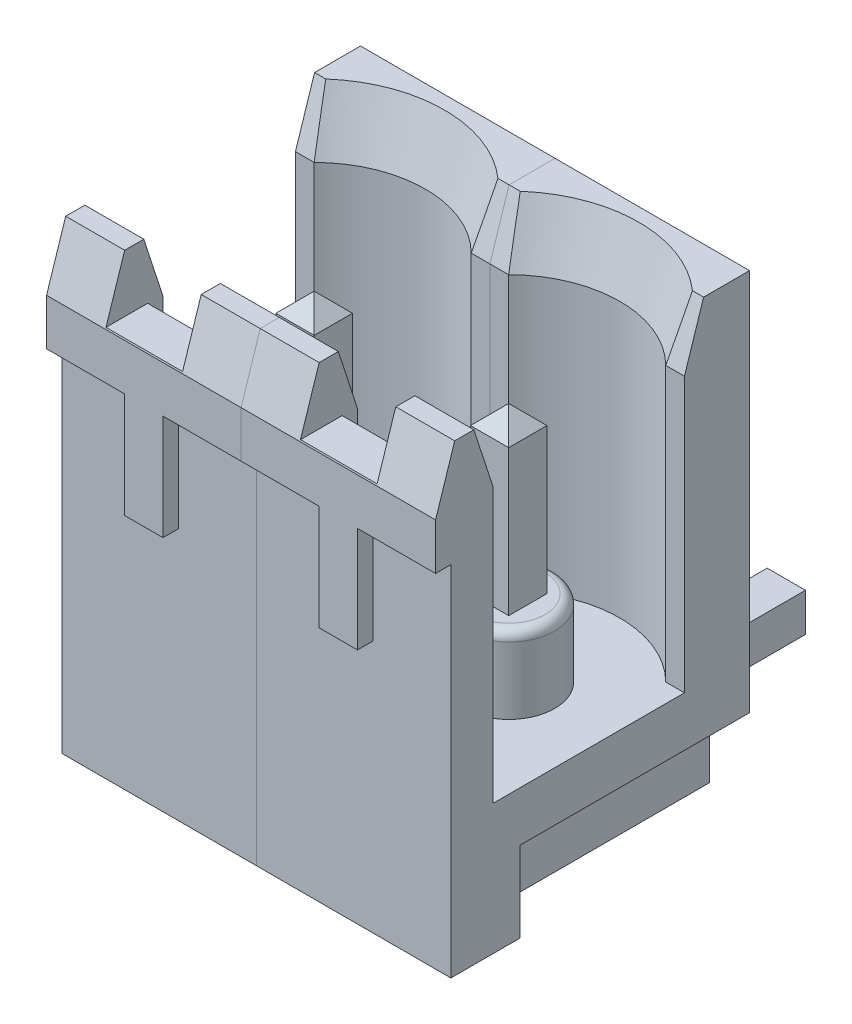
from build123d import *
from OCP.BRepFilletAPI import BRepFilletAPI_MakeChamfer

# Parameters (mm, degrees)
SKETCH_1_W             = 5.08
SKETCH_1_H             = 12.1
EXTRUDE_1_DEPTH        = 8.2
CUT_EXTRUDE_1_DEPTH    = 8.7
SKETCH_3_R             = 1.2
EXTRUDE_2_DEPTH        = 2
FILLET_1_R             = 0.25
CHAMFER_1_SIZE         = 0.5
CHAMFER_1_SIZE2        = 1.538841769
SKETCH_4_W             = 2
SKETCH_4_H             = 1.010953213
CUT_EXTRUDE_2_DEPTH    = 4.75
SKETCH_5_W             = 2
SKETCH_5_H             = 1.705458635
CUT_EXTRUDE_3_DEPTH    = 1.5
CHAMFER_2_SIZE         = 0.5
CHAMFER_2_SIZE2        = 1.538841769
SKETCH_6_W             = 5.08
SKETCH_6_H             = 6.6
CUT_EXTRUDE_4_DEPTH    = 0.4
SKETCH_7_W             = 2.04
SKETCH_7_H             = 2.75
CUT_EXTRUDE_5_DEPTH    = 0.4
EXTRUDE_1_2_DEPTH      = 0.5
EXTRUDE_1_2_DEPTH_BACK = 0.5
CHAMFER_3_SIZE         = 0.5
SKETCH_9_W             = 1
SKETCH_9_H             = 2.1
SKETCH_9_W_2           = 1.04
CUT_EXTRUDE_6_DEPTH    = 6
PATTERN_LINEAR_1_COUNT = 2
PATTERN_LINEAR_1_PITCH = 5.08
MOVE_BODY_1_ANGLE      = 180


with BuildPart() as part:
    # Эскиз1 → Extrude 1 (new body)
    with BuildSketch(Plane(origin=(0, 0, 0), x_dir=(1, 0, 0), z_dir=(0, 1, 0))):
        Rectangle(SKETCH_1_W, SKETCH_1_H)
    extrude(amount=EXTRUDE_1_DEPTH)

    # Эскиз2 → Вырез-Вытянуть1 (cut)
    with BuildSketch(Plane.XY.offset(6.05)):
        with BuildLine():
            Line((-2.54, 6.7), (2.54, 6.7))
            Line((2.54, 6.7), (2.54, 1.7))
            Line((2.54, 1.7), (2.05121915, 1.7))
            ThreePointArc((2.05121915, 1.7), (0, 0.85), (-2.05121915, 1.7))
            Line((-2.05121915, 1.7), (-2.54, 1.7))
            Line((-2.54, 1.7), (-2.54, 6.7))
        make_face()
    extrude(amount=-CUT_EXTRUDE_1_DEPTH, mode=Mode.SUBTRACT)

    # Эскиз3 → Бобышка-Вытянуть2 (add)
    with BuildSketch(Plane.XY.offset(-2.65)):
        with Locations((0, 3.75)):
            Circle(SKETCH_3_R)
    extrude(amount=EXTRUDE_2_DEPTH)

    # Скругление1
    fillet_1_edges = [part.edges().sort_by_distance(p)[0] for p in [
        (-1.2, 3.75, -0.65),
    ]]
    fillet(fillet_1_edges, radius=FILLET_1_R)

    # Фаска1: one chamfer whose edges measure the first distance from different faces: ONE call of the kernel's chamfer builder (chamfer() names one face for all edges)
    chamfer_1_edges_1 = [part.edges().sort_by_distance(p)[0] for p in [
        (0, 6.7, 6.05),
    ]]
    chamfer_1_side_1 = [part.faces().sort_by_distance(p)[0] for p in [
        (0, 7.45, 6.05),
    ]]
    chamfer_1_edges_2 = [part.edges().sort_by_distance(p)[0] for p in [
        (2.295609575, 1.7, 6.05),
        (-2.295609575, 1.7, 6.05),
        (0, 0.85, 6.05),
    ]]
    chamfer_1_side_2 = [part.faces().sort_by_distance(p)[0] for p in [
        (0, 0.655214235, 6.05),
    ]]
    chamfer_1 = BRepFilletAPI_MakeChamfer(part.part.solid().wrapped)
    for e in chamfer_1_edges_1:
        chamfer_1.Add(CHAMFER_1_SIZE, CHAMFER_1_SIZE2, e.wrapped, chamfer_1_side_1[0].wrapped)  # the first distance lies on this face
    for e in chamfer_1_edges_2:
        chamfer_1.Add(CHAMFER_1_SIZE, CHAMFER_1_SIZE2, e.wrapped, chamfer_1_side_2[0].wrapped)  # the first distance lies on this face
    add(Compound.cast(chamfer_1.Shape()), mode=Mode.REPLACE)

    # Эскиз4 → Вырез-Вытянуть2 (cut)
    with BuildSketch(Plane.XY.offset(6.05)):
        with Locations((0, 6.594523394)):
            Rectangle(SKETCH_4_W, SKETCH_4_H)
    extrude(amount=-CUT_EXTRUDE_2_DEPTH, mode=Mode.SUBTRACT)

    # Эскиз5 → Вырез-Вытянуть3 (cut)
    with BuildSketch(Plane.XY.offset(6.05)):
        with Locations((0, 7.552729318)):
            Rectangle(SKETCH_5_W, SKETCH_5_H)
    extrude(amount=-CUT_EXTRUDE_3_DEPTH, mode=Mode.SUBTRACT)

    # Фаска2
    chamfer_2_edges = [part.edges().sort_by_distance(p)[0] for p in [
        (-1.77, 8.2, 6.05),
    ]]
    chamfer_2_side = [part.faces().sort_by_distance(p)[0] for p in [
        (-1.77, 7.7, 6.05),
    ]]
    chamfer(chamfer_2_edges, length=CHAMFER_2_SIZE, length2=CHAMFER_2_SIZE2, reference=chamfer_2_side[0])

    # Эскиз6 → Вырез-Вытянуть4 (cut)
    with BuildSketch(Plane(origin=(0, 8.2, 0), x_dir=(1, 0, 0), z_dir=(0, 1, 0))):
        with Locations((0, 2.75)):
            Rectangle(SKETCH_6_W, SKETCH_6_H)
    extrude(amount=-CUT_EXTRUDE_4_DEPTH, mode=Mode.SUBTRACT)

    # Эскиз7 → Вырез-Вытянуть5 (cut)
    with BuildSketch(Plane(origin=(0, 8.2, 0), x_dir=(1, 0, 0), z_dir=(0, 1, 0))):
        with Locations((1.52, -1.925)):
            Rectangle(SKETCH_7_W, SKETCH_7_H)
        with Locations((-1.52, -1.925)):
            Rectangle(SKETCH_7_W, SKETCH_7_H)
    extrude(amount=-CUT_EXTRUDE_5_DEPTH, mode=Mode.SUBTRACT)

    # Эскиз9 → Вырез-Вытянуть6 (cut)
    with BuildSketch(Plane.XZ):
        with Locations((0, -5)):
            Rectangle(SKETCH_9_W, SKETCH_9_H)
        with Locations((-2.02, -5)):
            Rectangle(SKETCH_9_W_2, SKETCH_9_H)
        with Locations((2.02, -5)):
            Rectangle(SKETCH_9_W_2, SKETCH_9_H)
    extrude(amount=-CUT_EXTRUDE_6_DEPTH, mode=Mode.SUBTRACT)


with BuildPart() as body_2:
    # Эскиз8 → Extrude 1 2 (new, two sides: drawn at the far end of the back side and taken through both)
    with BuildSketch(Plane(origin=(0, 0, 0), x_dir=(0, 0, -1), z_dir=(1, 0, 0)).offset(-EXTRUDE_1_2_DEPTH_BACK)):
        with BuildLine():
            Line((-3.65, 3.25), (3.95, 3.25))
            Line((3.95, 3.25), (3.95, -4))
            Line((3.95, -4), (4.95, -4))
            Line((4.95, -4), (4.95, 3.25))
            ThreePointArc((4.95, 3.25), (4.657106781, 3.957106781), (3.95, 4.25))
            Line((3.95, 4.25), (-3.65, 4.25))
            Line((-3.65, 4.25), (-3.65, 3.25))
        make_face()
    extrude(amount=EXTRUDE_1_2_DEPTH + EXTRUDE_1_2_DEPTH_BACK)

    # Фаска3
    chamfer_3_edges = [body_2.edges().sort_by_distance(p)[0] for p in [
        (0, 3.25, 3.65),
        (0, 4.25, 3.65),
        (0, -4, -4.95),
        (0, -4, -3.95),
        (0.5, -4, -4.45),
        (0.5, 3.75, 3.65),
        (-0.5, 3.75, 3.65),
        (-0.5, -4, -4.45),
    ]]
    chamfer(chamfer_3_edges, length=CHAMFER_3_SIZE - 0.0001)  # a hair under: the kernel refuses the full size


with BuildPart() as pattern_linear_1_1:
    # Линейный массив1: pattern copy
    add(body_2.part.moved(Location(Vector(-1, 0, 0) * (1 * PATTERN_LINEAR_1_PITCH))))


with BuildPart() as pattern_linear_1_2:
    # Линейный массив1: pattern copy
    add(part.part.moved(Location(Vector(-1, 0, 0) * (1 * PATTERN_LINEAR_1_PITCH))))


with BuildPart() as body_2_1:
    # Move Body 1: moved
    add(body_2.part.rotate(Axis((0, 0, 0), (0, 0.7071067811865488, 0.7071067811865462)), MOVE_BODY_1_ANGLE))


with BuildPart() as part_1:
    # Move Body 1: moved
    add(part.part.rotate(Axis((0, 0, 0), (0, 0.7071067811865488, 0.7071067811865462)), MOVE_BODY_1_ANGLE))


with BuildPart() as pattern_linear_1_1_1:
    # Move Body 1: moved
    add(pattern_linear_1_1.part.rotate(Axis((0, 0, 0), (0, 0.7071067811865488, 0.7071067811865462)), MOVE_BODY_1_ANGLE))


with BuildPart() as pattern_linear_1_2_1:
    # Move Body 1: moved
    add(pattern_linear_1_2.part.rotate(Axis((0, 0, 0), (0, 0.7071067811865488, 0.7071067811865462)), MOVE_BODY_1_ANGLE))


with BuildPart() as pattern_linear_1_2_2:
    # Move Body 2: read off the stored shape, not the designer's step
    # Move Body 2: moved
    add(pattern_linear_1_2_1.part.moved(Location((0, 4.45, 0))))


with BuildPart() as pattern_linear_1_1_2:
    # Move Body 2 2: moved
    add(pattern_linear_1_1_1.part.moved(Location((0, 4.45, 0))))


with BuildPart() as part_2:
    # Move Body 2 3: moved
    add(part_1.part.moved(Location((0, 4.45, 0))))


with BuildPart() as body_2_2:
    # Move Body 2 4: moved
    add(body_2_1.part.moved(Location((0, 4.45, 0))))


solid = Compound([pattern_linear_1_2_2.part, pattern_linear_1_1_2.part, part_2.part, body_2_2.part])
